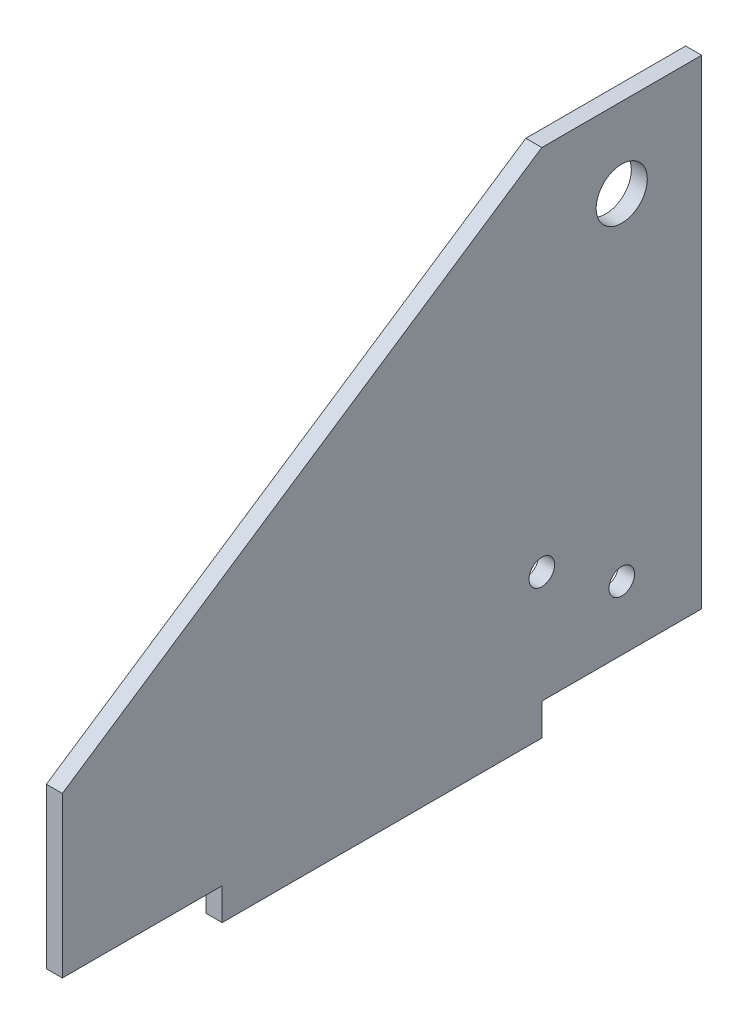
from build123d import *

# Parameters (mm, degrees)
CROQUIS1_R              = 8
CROQUIS1_R_2            = 4
SALIENTE_EXTRUIR1_DEPTH = 5


with BuildPart() as part:
    # Croquis1 → Saliente-Extruir1 (new body)
    with BuildSketch(Plane(origin=(0, 0, 0), x_dir=(0, 0, -1), z_dir=(1, 0, 0))):
        Polygon((50, 75), (-100, -25), (-100, -75), (-50, -75), (-50, -85), (50, -85), (50, -75), (100, -75), (100, 75), align=None)
        with Locations((75, 50)):
            Circle(CROQUIS1_R, mode=Mode.SUBTRACT)
        with Locations((75, -55)):
            Circle(CROQUIS1_R_2, mode=Mode.SUBTRACT)
        with Locations((50, -40)):
            Circle(CROQUIS1_R_2, mode=Mode.SUBTRACT)
    extrude(amount=SALIENTE_EXTRUIR1_DEPTH)


solid = part.part
